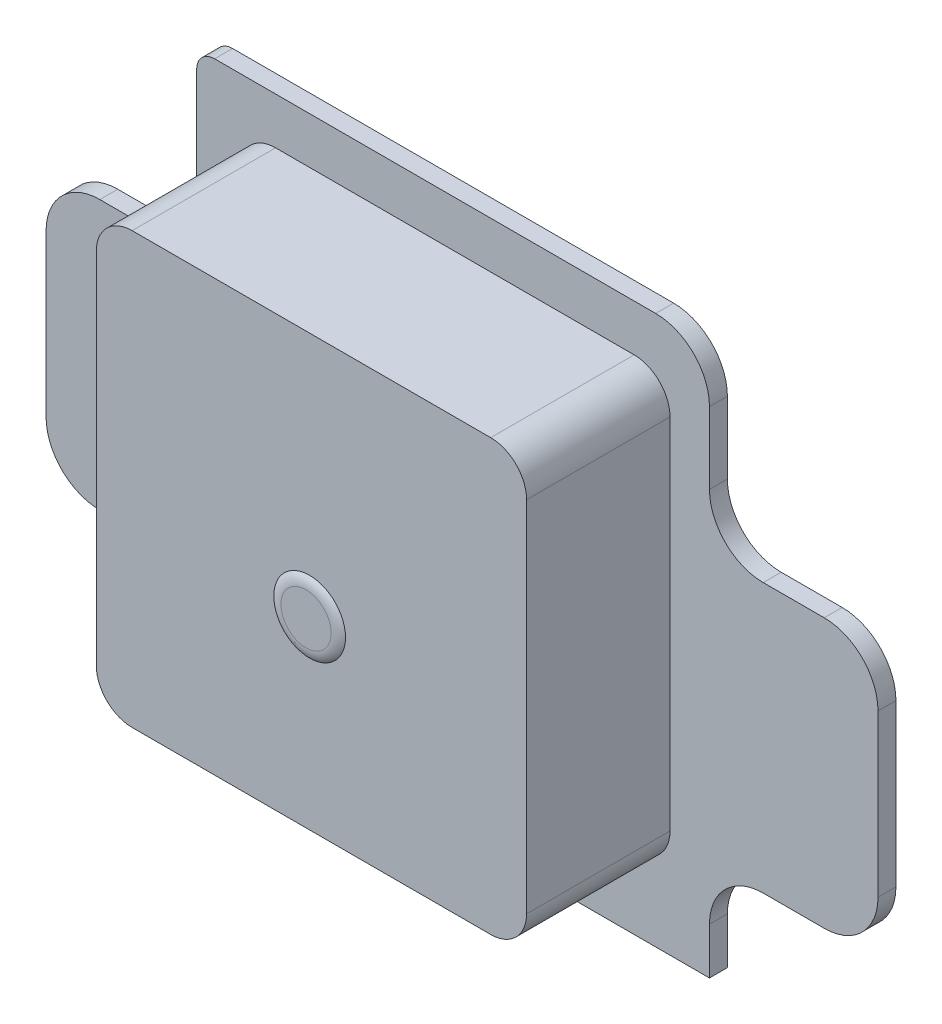
from build123d import *

# Parameters (mm, degrees)
SKETCH_1_W      = 14.3
SKETCH_1_H      = 15.3
EXTRUDE_1_DEPTH = 0.5
SKETCH_2_W      = 4.2
SKETCH_2_H      = 7.5
SKETCH_2_W_2    = 4.7
EXTRUDE_2_DEPTH = 0.5
FILLET_1_R      = 1.5
FILLET_2_R      = 0.5
SKETCH_3_W      = 12
SKETCH_3_H      = 12
EXTRUDE_3_DEPTH = 4
FILLET_3_R      = 1
SKETCH_4_R      = 1
EXTRUDE_4_DEPTH = 0.1
FILLET_4_R      = 0.5


with BuildPart() as part:
    # ｽｹｯﾁ1 → ﾎﾞｽ - 押し出し1 (new body)
    with BuildSketch(Plane.XY):
        Rectangle(SKETCH_1_W, SKETCH_1_H)
    extrude(amount=EXTRUDE_1_DEPTH)

    # ｽｹｯﾁ2 → ﾎﾞｽ - 押し出し2 (add)
    with BuildSketch(Plane.XY.offset(0.5)):
        with Locations((-9.25, -1.1)):
            Rectangle(SKETCH_2_W, SKETCH_2_H)
        with Locations((9.5, -1.1)):
            Rectangle(SKETCH_2_W_2, SKETCH_2_H)
    extrude(amount=-EXTRUDE_2_DEPTH)

    # ﾌｨﾚｯﾄ1
    fillet_1_edges = [part.edges().sort_by_distance(p)[0] for p in [
        (-7.15, 2.65, 0.25),
        (-7.15, -4.85, 0.25),
        (-11.35, -4.85, 0.25),
        (-11.35, 2.65, 0.25),
        (7.15, -4.85, 0.25),
        (7.15, 2.65, 0.25),
        (11.85, 2.65, 0.25),
        (11.85, -4.85, 0.25),
        (7.15, 7.65, 0.25),
    ]]
    fillet(fillet_1_edges, radius=FILLET_1_R)

    # ﾌｨﾚｯﾄ2
    fillet_2_edges = [part.edges().sort_by_distance(p)[0] for p in [
        (-7.15, 7.65, 0.25),
    ]]
    fillet(fillet_2_edges, radius=FILLET_2_R)

    # ｽｹｯﾁ3 → ﾎﾞｽ - 押し出し3 (add)
    with BuildSketch(Plane.XY.offset(0.5)):
        with Locations((0.05, 0.35)):
            Rectangle(SKETCH_3_W, SKETCH_3_H)
    extrude(amount=EXTRUDE_3_DEPTH)

    # ﾌｨﾚｯﾄ3
    fillet_3_edges = [part.edges().sort_by_distance(p)[0] for p in [
        (-5.95, 6.35, 2.5),
        (-5.95, -5.65, 2.5),
        (6.05, -5.65, 2.5),
        (6.05, 6.35, 2.5),
    ]]
    fillet(fillet_3_edges, radius=FILLET_3_R)

    # ｽｹｯﾁ4 → ﾎﾞｽ - 押し出し4 (add)
    with BuildSketch(Plane.XY.offset(4.5)):
        with Locations((0, -0.5)):
            Circle(SKETCH_4_R)
    extrude(amount=EXTRUDE_4_DEPTH)

    # ﾌｨﾚｯﾄ4
    # the kernel refuses this fillet: 0.5 mm, written as the material it takes off along each edge
    with BuildSketch(Plane(origin=(0, -0.5, 4.6), x_dir=(1, 0, 0), z_dir=(0, -1, 0))) as fillet_4_piece_1:
        with BuildLine():
            CenterArc((0.7, -0.5), FILLET_4_R, 53.130102354, 36.869897646)
            Line((0.7, 0), (0.7, 0.01))
            Line((0.7, 0.01), (1, 0.01))
            Line((1, 0.01), (1.01, 0))
            ThreePointArc((1.01, 0), (1.01, -0.05), (1.006, -0.092))
            Line((1.006, -0.092), (1, -0.1))
        make_face()
    revolve(axis=Axis((0, -0.5, 4.6), (0, 0, 1)), mode=Mode.SUBTRACT)


solid = part.part
